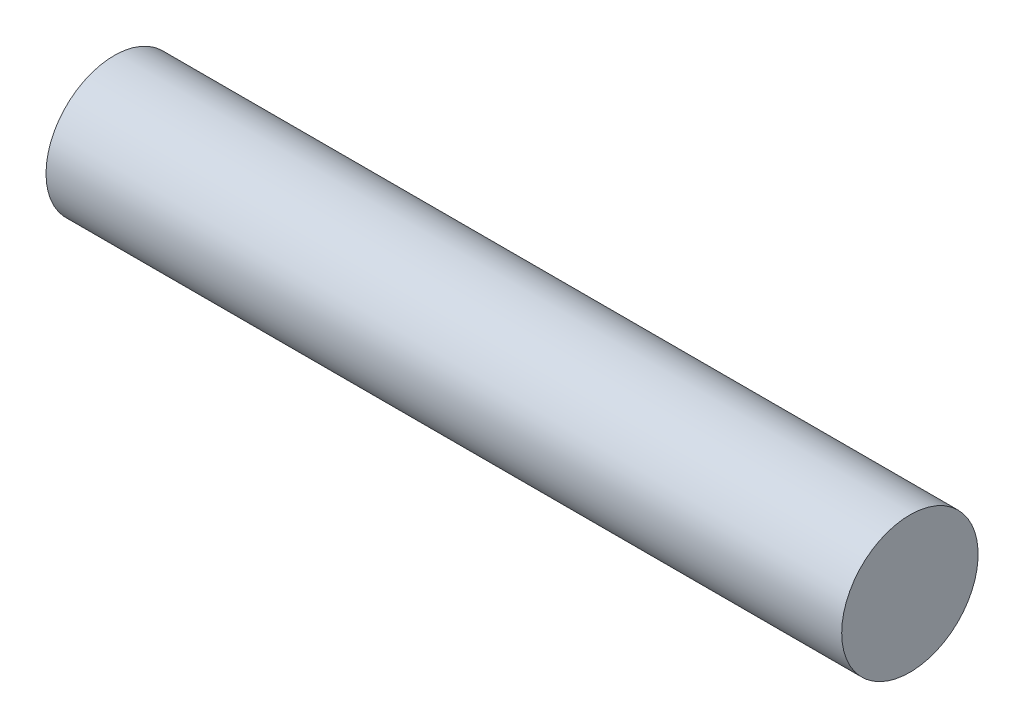
from build123d import *

# Parameters (mm, degrees)
SKETCH1_W = 34.9915
SKETCH1_H = 3


with BuildPart() as part:
    # Sketch1 → Revolve1 (revolve)
    with BuildSketch(Plane.XY):
        with Locations((17.49575, 1.5)):
            Rectangle(SKETCH1_W, SKETCH1_H)
    revolve(axis=Axis((0, 0, 0), (1, 0, 0)))


solid = part.part
